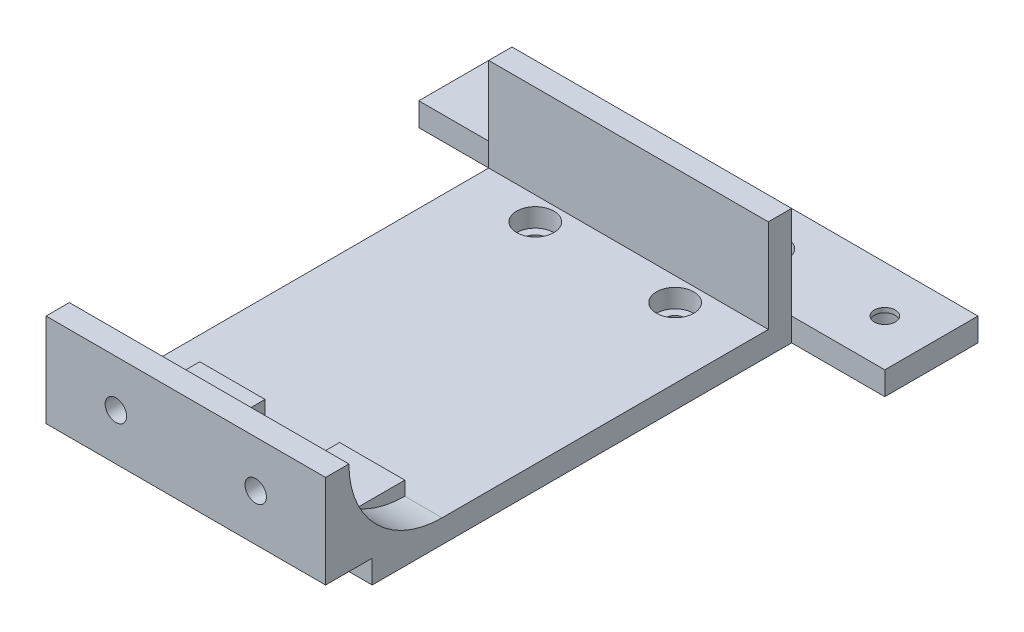
from build123d import *

# Parameters (mm, degrees)
SKETCH_1_W                   = 60
SKETCH_1_H                   = 20
EXTRUDE_1_DEPTH              = 20
SKETCH_2_W                   = 60
SKETCH_2_H                   = 40
EXTRUDE_2_DEPTH              = 5
SKETCH_3_W                   = 20
SKETCH_3_H                   = 5
EXTRUDE_3_DEPTH              = 20
HOLE_WIZARD_M4_2_D           = 4.5
HOLE_WIZARD_M4_2_CBORE_D     = 8
HOLE_WIZARD_M4_2_CBORE_DEPTH = 4
SKETCH_8_W                   = 15
SKETCH_8_H                   = 20
CUT_EXTRUDE_1_DEPTH          = 84.815273071
HOLE_WIZARD_M4_1_D           = 4.5
HOLE_WIZARD_M4_1_CBORE_D     = 8
HOLE_WIZARD_M4_1_CBORE_DEPTH = 4
SKETCH_10_W                  = 60
SKETCH_10_H                  = 5
EXTRUDE_4_DEPTH              = 80
SKETCH_11_W                  = 60
SKETCH_11_H                  = 5
EXTRUDE_5_DEPTH              = 20
FILLET_1_R                   = 20
SKETCH_12_W                  = 10
SKETCH_12_H                  = 5
CUT_EXTRUDE_2_DEPTH          = 129.937969582
SKETCH_13_W                  = 14
SKETCH_13_H                  = 20
CUT_EXTRUDE_3_DEPTH          = 35
SKETCH_14_W                  = 14
SKETCH_14_H                  = 3
EXTRUDE_6_DEPTH              = 20
HOLE_WIZARD_M4_1_2_D         = 4.6
HOLE_WIZARD_M4_1_2_DEPTH     = 5


with BuildPart() as part:
    # 스케치1 → 보스-돌출1 (new body)
    with BuildSketch(Plane.XY):
        Rectangle(SKETCH_1_W, SKETCH_1_H)
    extrude(amount=EXTRUDE_1_DEPTH)

    # 스케치2 → 보스-돌출2 (add)
    with BuildSketch(Plane.XZ.offset(10)):
        Rectangle(SKETCH_2_W, SKETCH_2_H)
    extrude(amount=EXTRUDE_2_DEPTH)

    # 스케치3 → 보스-돌출3 (add)
    with BuildSketch(Plane(origin=(30, 0, 0), x_dir=(0, 0, -1), z_dir=(1, 0, 0))):
        with Locations((10, -12.5)):
            Rectangle(SKETCH_3_W, SKETCH_3_H)
    extrude_3 = extrude(amount=EXTRUDE_3_DEPTH)

    # 대칭 복사1: 보스-돌출3 across plane
    add(extrude_3.mirror(Plane.ZY))

    # M4 소켓 머리 캡 나사용 카운터보어2 (through all)
    with Locations(Plane(origin=(0, -15, 0), x_dir=(-1, 0, 0), z_dir=(0, -1, 0))):
        with Locations((40, 10), (-40, 10)):
            CounterBoreHole(HOLE_WIZARD_M4_2_D / 2, HOLE_WIZARD_M4_2_CBORE_D / 2, HOLE_WIZARD_M4_2_CBORE_DEPTH)

    # 스케치8 → 컷-돌출1 (cut, through all)
    with BuildSketch(Plane(origin=(30, 0, 0), x_dir=(0, 0, -1), z_dir=(1, 0, 0))):
        with Locations((-12.5, 0)):
            Rectangle(SKETCH_8_W, SKETCH_8_H)
    extrude(amount=-CUT_EXTRUDE_1_DEPTH, mode=Mode.SUBTRACT)

    # Hole Wizard M4 _ _ _ _ _1 (through all)
    with Locations(Plane(origin=(0, -10, 0), x_dir=(1, 0, 0), z_dir=(0, 1, 0))):
        with Locations((-15, 10), (15, 10), (-15, -10), (15, -10)):
            CounterBoreHole(HOLE_WIZARD_M4_1_D / 2, HOLE_WIZARD_M4_1_CBORE_D / 2, HOLE_WIZARD_M4_1_CBORE_DEPTH)

    # 스케치10 → 보스-돌출4 (add)
    with BuildSketch(Plane.XY.offset(20)):
        with Locations((0, -12.5)):
            Rectangle(SKETCH_10_W, SKETCH_10_H)
    extrude(amount=EXTRUDE_4_DEPTH)

    # 스케치11 → 보스-돌출5 (add)
    with BuildSketch(Plane(origin=(0, -10, 0), x_dir=(1, 0, 0), z_dir=(0, 1, 0))):
        with Locations((0, -97.5)):
            Rectangle(SKETCH_11_W, SKETCH_11_H)
    extrude(amount=EXTRUDE_5_DEPTH)

    # 필렛1
    fillet_1_edges = [part.edges().sort_by_distance(p)[0] for p in [
        (0, -10, 95),
    ]]
    fillet(fillet_1_edges, radius=FILLET_1_R - 0.0001)  # a hair under: the kernel refuses the full size

    # 스케치12 → 컷-돌출2 (cut, through all)
    with BuildSketch(Plane.ZY.offset(30)):
        with Locations((95, -12.5)):
            Rectangle(SKETCH_12_W, SKETCH_12_H)
    extrude(amount=-CUT_EXTRUDE_2_DEPTH, mode=Mode.SUBTRACT)

    # 스케치13 → 컷-돌출3 (cut)
    with BuildSketch(Plane.XY.offset(60)):
        with Locations((-15, 0)):
            Rectangle(SKETCH_13_W, SKETCH_13_H)
        with Locations((15, 0)):
            Rectangle(SKETCH_13_W, SKETCH_13_H)
    extrude(amount=CUT_EXTRUDE_3_DEPTH, mode=Mode.SUBTRACT)

    # 스케치14 → 보스-돌출6 (add)
    with BuildSketch(Plane(origin=(0, 0, 95), x_dir=(-1, 0, 0), z_dir=(0, 0, -1))):
        with Locations((-15, -8.5)):
            Rectangle(SKETCH_14_W, SKETCH_14_H)
        with Locations((15, -8.5)):
            Rectangle(SKETCH_14_W, SKETCH_14_H)
    extrude(amount=EXTRUDE_6_DEPTH)

    # Hole Wizard M4 _ _1 2
    with Locations(Plane(origin=(0, 0, 95), x_dir=(-1, 0, 0), z_dir=(0, 0, -1))):
        with Locations((-15, 0), (15, 0)):
            Hole(HOLE_WIZARD_M4_1_2_D / 2, depth=HOLE_WIZARD_M4_1_2_DEPTH)


solid = part.part
